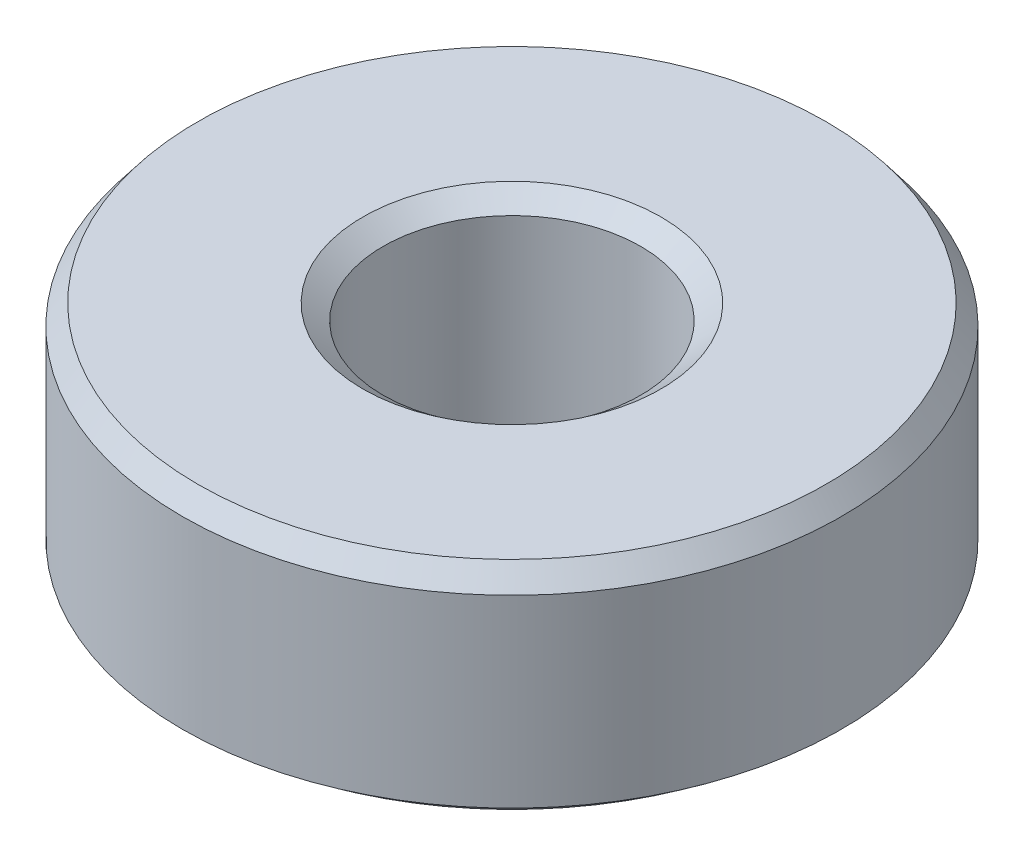
from build123d import *
from OCP.BRepFilletAPI import BRepFilletAPI_MakeChamfer

# Parameters (mm, degrees)
SKETCH1_R           = 60
BOSS_EXTRUDE1_DEPTH = 40.035866154
SKETCH2_R           = 23.468876871
CUT_EXTRUDE1_DEPTH  = 94.823614185
CHAMFER1_SIZE       = 3.669948392
CHAMFER1_SIZE2      = 2.811507357


with BuildPart() as part:
    # Sketch1 → Boss-Extrude1 (new body)
    with BuildSketch(Plane(origin=(0, 0, 0), x_dir=(1, 0, 0), z_dir=(0, 1, 0))):
        Circle(SKETCH1_R)
    extrude(amount=BOSS_EXTRUDE1_DEPTH)

    # Sketch2 → Cut-Extrude1 (cut, through all)
    with BuildSketch(Plane(origin=(0, 0, 0), x_dir=(1, 0, 0), z_dir=(0, 1, 0))):
        Circle(SKETCH2_R)
    extrude(amount=CUT_EXTRUDE1_DEPTH, mode=Mode.SUBTRACT)

    # Chamfer1: one chamfer whose edges measure the first distance from different faces: ONE call of the kernel's chamfer builder (chamfer() names one face for all edges)
    chamfer1_edges_1 = [part.edges().sort_by_distance(p)[0] for p in [
        (-23.468876871, 40.035866154, 0),
    ]]
    chamfer1_side_1 = [part.faces().sort_by_distance(p)[0] for p in [
        (-58.302943725, 40.035866154, 0),
    ]]
    chamfer1_edges_2 = [part.edges().sort_by_distance(p)[0] for p in [
        (-23.468876871, 0, 0),
    ]]
    chamfer1_side_2 = [part.faces().sort_by_distance(p)[0] for p in [
        (-23.468876871, 20.017933077, 0),
    ]]
    chamfer1_edges_3 = [part.edges().sort_by_distance(p)[0] for p in [
        (-60, 0, 0),
    ]]
    chamfer1_side_3 = [part.faces().sort_by_distance(p)[0] for p in [
        (-58.302943725, 0, 0),
    ]]
    chamfer1_edges_4 = [part.edges().sort_by_distance(p)[0] for p in [
        (-60, 40.035866154, 0),
    ]]
    chamfer1_side_4 = [part.faces().sort_by_distance(p)[0] for p in [
        (-60, 20.017933077, 0),
    ]]
    chamfer1 = BRepFilletAPI_MakeChamfer(part.part.solid().wrapped)
    for e in chamfer1_edges_1:
        chamfer1.Add(CHAMFER1_SIZE, CHAMFER1_SIZE2, e.wrapped, chamfer1_side_1[0].wrapped)  # the first distance lies on this face
    for e in chamfer1_edges_2:
        chamfer1.Add(CHAMFER1_SIZE, CHAMFER1_SIZE2, e.wrapped, chamfer1_side_2[0].wrapped)  # the first distance lies on this face
    for e in chamfer1_edges_3:
        chamfer1.Add(CHAMFER1_SIZE, CHAMFER1_SIZE2, e.wrapped, chamfer1_side_3[0].wrapped)  # the first distance lies on this face
    for e in chamfer1_edges_4:
        chamfer1.Add(CHAMFER1_SIZE, CHAMFER1_SIZE2, e.wrapped, chamfer1_side_4[0].wrapped)  # the first distance lies on this face
    add(Compound.cast(chamfer1.Shape()), mode=Mode.REPLACE)


solid = part.part
